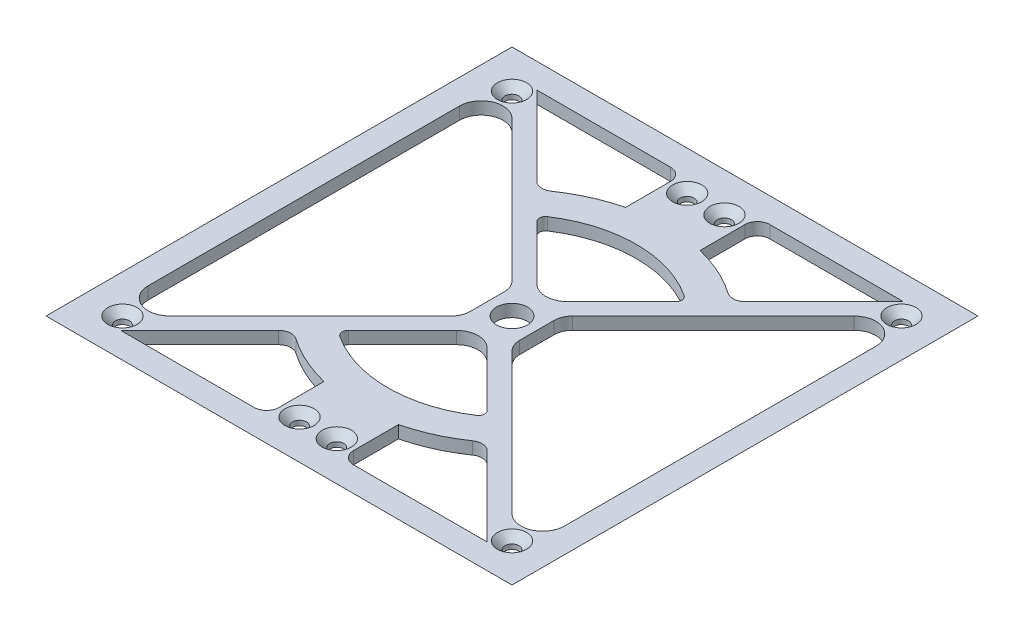
from build123d import *

# Parameters (mm, degrees)
BOSS_EXTRUDE2_DEPTH                            = 4
SKETCH2_R                                      = 5
CUT_EXTRUDE1_DEPTH                             = 107.141415103
CSK_FOR_M4_FLAT_HEAD_MACHINE_SCREW2_AT_2_COUNT = 2
CSK_FOR_M4_FLAT_HEAD_MACHINE_SCREW2_AT_2_PITCH = 12
CHAMFER1_SIZE                                  = 4


with BuildPart() as part:
    # Sketch1 → Boss-Extrude2 (new body)
    with BuildSketch(Plane(origin=(0, 0, 0), x_dir=(1, 0, 0), z_dir=(0, 1, 0))):
        Polygon((-75, 75), (-75, -75), (-67, -75), (67, -75), (75, -75), (75, 75), (67, 75), (-67, 75), align=None)
        with BuildLine():
            ThreePointArc((-22.004968974, 33.403313316), (0, 40), (22.004968974, 33.403313316))
            ThreePointArc((22.004968974, 33.403313316), (22.894438748, 31.935685036), (22.318934087, 30.318934087))
            Line((22.318934087, 30.318934087), (4.949747468, 12.949747468))
            ThreePointArc((4.949747468, 12.949747468), (0, 10.899494937), (-4.949747468, 12.949747468))
            Line((-4.949747468, 12.949747468), (-22.318934087, 30.318934087))
            ThreePointArc((-22.318934087, 30.318934087), (-22.894438748, 31.935685036), (-22.004968974, 33.403313316))
        make_face(mode=Mode.SUBTRACT)
        with BuildLine():
            Line((8, -5.514718626), (8, 5.514718626))
            ThreePointArc((8, 5.514718626), (8.456722805, 7.81081922), (9.757359313, 9.757359313))
            Line((9.757359313, 9.757359313), (55.050252532, 55.050252532))
            ThreePointArc((55.050252532, 55.050252532), (62.678784027, 56.567661791), (67, 50.100505063))
            Line((67, 50.100505063), (67, -50.100505063))
            ThreePointArc((67, -50.100505063), (62.678784027, -56.567661791), (55.050252532, -55.050252532))
            Line((55.050252532, -55.050252532), (9.757359313, -9.757359313))
            ThreePointArc((9.757359313, -9.757359313), (8.456722805, -7.81081922), (8, -5.514718626))
        make_face(mode=Mode.SUBTRACT)
        with BuildLine():
            Line((-16, -67), (-59, -67))
            Line((-59, -67), (-33.568239019, -41.568239019))
            ThreePointArc((-33.568239019, -41.568239019), (-31.098923321, -40.412818885), (-28.462788791, -41.108024207))
            ThreePointArc((-28.462788791, -41.108024207), (-20.569707054, -45.572877369), (-12, -48.538644398))
            Line((-12, -48.538644398), (-12, -63))
            ThreePointArc((-12, -63), (-13.171572875, -65.828427125), (-16, -67))
        make_face(mode=Mode.SUBTRACT)
        with BuildLine():
            Line((33.568239019, -41.568239019), (59, -67))
            Line((59, -67), (16, -67))
            ThreePointArc((16, -67), (13.171572875, -65.828427125), (12, -63))
            Line((12, -63), (12, -48.538644398))
            ThreePointArc((12, -48.538644398), (20.569707054, -45.572877369), (28.462788791, -41.108024207))
            ThreePointArc((28.462788791, -41.108024207), (31.098923321, -40.412818885), (33.568239019, -41.568239019))
        make_face(mode=Mode.SUBTRACT)
        with BuildLine():
            ThreePointArc((-4.949747468, -12.949747468), (0, -10.899494937), (4.949747468, -12.949747468))
            Line((4.949747468, -12.949747468), (22.318934087, -30.318934087))
            ThreePointArc((22.318934087, -30.318934087), (22.894438748, -31.935685036), (22.004968974, -33.403313316))
            ThreePointArc((22.004968974, -33.403313316), (0, -40), (-22.004968974, -33.403313316))
            ThreePointArc((-22.004968974, -33.403313316), (-22.894438748, -31.935685036), (-22.318934087, -30.318934087))
            Line((-22.318934087, -30.318934087), (-4.949747468, -12.949747468))
        make_face(mode=Mode.SUBTRACT)
        with BuildLine():
            Line((-67, -50.100505063), (-67, 50.100505063))
            ThreePointArc((-67, 50.100505063), (-62.678784027, 56.567661791), (-55.050252532, 55.050252532))
            Line((-55.050252532, 55.050252532), (-9.757359313, 9.757359313))
            ThreePointArc((-9.757359313, 9.757359313), (-8.456722805, 7.81081922), (-8, 5.514718626))
            Line((-8, 5.514718626), (-8, -5.514718626))
            ThreePointArc((-8, -5.514718626), (-8.456722805, -7.81081922), (-9.757359313, -9.757359313))
            Line((-9.757359313, -9.757359313), (-55.050252532, -55.050252532))
            ThreePointArc((-55.050252532, -55.050252532), (-62.678784027, -56.567661791), (-67, -50.100505063))
        make_face(mode=Mode.SUBTRACT)
        with BuildLine():
            Line((-33.568239019, 41.568239019), (-59, 67))
            Line((-59, 67), (-16, 67))
            ThreePointArc((-16, 67), (-13.171572875, 65.828427125), (-12, 63))
            Line((-12, 63), (-12, 48.538644398))
            ThreePointArc((-12, 48.538644398), (-20.569707054, 45.572877369), (-28.462788791, 41.108024207))
            ThreePointArc((-28.462788791, 41.108024207), (-31.098923321, 40.412818885), (-33.568239019, 41.568239019))
        make_face(mode=Mode.SUBTRACT)
        with BuildLine():
            Line((59, 67), (33.568239019, 41.568239019))
            ThreePointArc((33.568239019, 41.568239019), (31.098923321, 40.412818885), (28.462788791, 41.108024207))
            ThreePointArc((28.462788791, 41.108024207), (20.569707054, 45.572877369), (12, 48.538644398))
            Line((12, 48.538644398), (12, 63))
            ThreePointArc((12, 63), (13.171572875, 65.828427125), (16, 67))
            Line((16, 67), (59, 67))
        make_face(mode=Mode.SUBTRACT)
    extrude(amount=BOSS_EXTRUDE2_DEPTH)

    # Sketch2 → Cut-Extrude1 (cut, through all)
    with BuildSketch(Plane(origin=(0, 4, 0), x_dir=(1, 0, 0), z_dir=(0, 1, 0))):
        with Locations(Location((0, 0, 0), (0, 0, 270))):
            Circle(SKETCH2_R)
    extrude(amount=-CUT_EXTRUDE1_DEPTH, mode=Mode.SUBTRACT)

    # Sketch4 → CSK for M4 Flat Head Machine Screw1 (revolve, cut)
    with BuildSketch(Plane(origin=(-62.687827406, 4, -62.687827406), x_dir=(0, 0, 1), z_dir=(1, 0, 0))):
        Polygon((0, 0), (0, 4), (2.25, 4), (2.25, 2.45), (4.7, 0), align=None)
    csk_for_m4_flat_head_machine_screw1 = revolve(axis=Axis((-62.687827406, 10.35, -62.687827406), (0, -1, 0)), mode=Mode.SUBTRACT)

    # Mirror1: CSK for M4 Flat Head Machine Screw1 across plane
    add(csk_for_m4_flat_head_machine_screw1.mirror(Plane.XY), mode=Mode.SUBTRACT)

    # Mirror1 at the second plane: CSK for M4 Flat Head Machine Screw1 across plane
    add(csk_for_m4_flat_head_machine_screw1.mirror(Plane(origin=(0, 0, 0), x_dir=(0, 0, 1), z_dir=(1, 0, 0))), mode=Mode.SUBTRACT)

    # Mirror1 at the second plane copy 1 sketc → Mirror1 at the second plane copy 1 (revolve, cut)
    with BuildSketch(Plane(origin=(62.687827406, 4, 62.687827406), x_dir=(0, 0, -1), z_dir=(-1, 0, 0))):
        Polygon((0, 0), (0, 4), (2.25, 4), (2.25, 2.45), (4.7, 0), align=None)
    revolve(axis=Axis((62.687827406, 10.35, 62.687827406), (0, -1, 0)), mode=Mode.SUBTRACT)

    # Sketch10 → CSK for M4 Flat Head Machine Screw2 (revolve, cut)
    with BuildSketch(Plane(origin=(6, 4, -62.3846611), x_dir=(0, 0, 1), z_dir=(1, 0, 0))):
        Polygon((0, 0), (0, 4), (2.25, 4), (2.25, 2.45), (4.7, 0), align=None)
    csk_for_m4_flat_head_machine_screw2 = revolve(axis=Axis((6, 10.35, -62.3846611), (0, -1, 0)), mode=Mode.SUBTRACT)

    # CSK for M4 Flat Head Machine Screw2 at 2: CSK for M4 Flat Head Machine Screw2 ×2
    with Locations(*[(-i * CSK_FOR_M4_FLAT_HEAD_MACHINE_SCREW2_AT_2_PITCH, 0, 0) for i in range(1, CSK_FOR_M4_FLAT_HEAD_MACHINE_SCREW2_AT_2_COUNT)]):
        add(csk_for_m4_flat_head_machine_screw2, mode=Mode.SUBTRACT)

    # Mirror2: CSK for M4 Flat Head Machine Screw2 across plane
    add(csk_for_m4_flat_head_machine_screw2.mirror(Plane.XY), mode=Mode.SUBTRACT)

    # Mirror2 copy 1 sketch → Mirror2 copy 1 (revolve, cut)
    with BuildSketch(Plane(origin=(-6, 4, 62.3846611), x_dir=(0, 0, -1), z_dir=(1, 0, 0))):
        Polygon((0, 0), (0, -4), (2.25, -4), (2.25, -2.45), (4.7, 0), align=None)
    revolve(axis=Axis((-6, 10.35, 62.3846611), (0, 1, 0)), mode=Mode.SUBTRACT)

    # Chamfer1
    chamfer1_edges = [part.edges().sort_by_distance(p)[0] for p in [
        (0, 0, -75),
        (-75, 0, 0),
        (0, 0, 75),
        (75, 0, 0),
    ]]
    chamfer(chamfer1_edges, length=CHAMFER1_SIZE - 0.0001)  # a hair under: the kernel refuses the full size


solid = part.part
